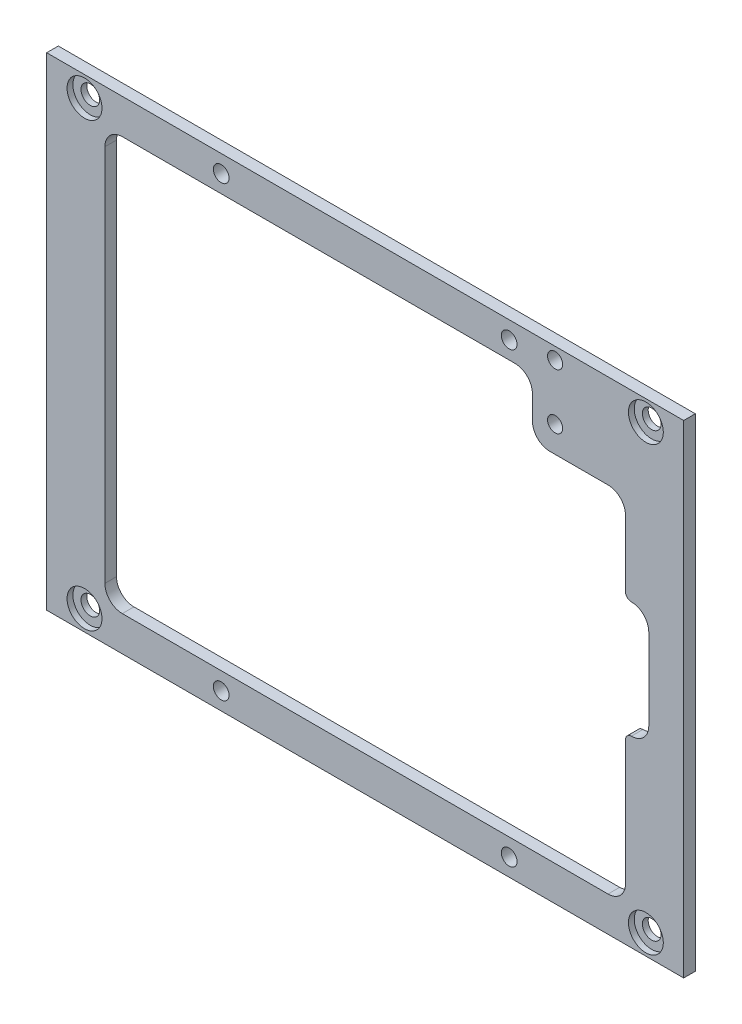
from build123d import *

# Parameters (mm, degrees)
SKETCH1_W                  = 109.5
SKETCH1_H                  = 83
BOSS_EXTRUDE1_DEPTH        = 2
F_3_2_3_2_DIAMETER_HOLE2_D = 3.2
F_2_6_2_6_DIAMETER_HOLE2_D = 2.6
F_2_6_2_6_DIAMETER_HOLE1_D = 2.6
SKETCH9_R                  = 3
CUT_EXTRUDE1_DEPTH         = 1
F_2_7_2_7_DIAMETER_HOLE1_D = 2.7
FILLET1_R                  = 1
FILLET2_R                  = 3


with BuildPart() as part:
    # Sketch1 → Boss-Extrude1 (new body)
    with BuildSketch(Plane.XY):
        with Locations((0, -41.5)):
            Rectangle(SKETCH1_W, SKETCH1_H)
        with BuildLine():
            Line((28.75, -9), (28.75, -13.1))
            ThreePointArc((28.75, -13.1), (29.628679656, -15.221320344), (31.75, -16.1))
            Line((31.75, -16.1), (41.75, -16.1))
            ThreePointArc((41.75, -16.1), (43.871320344, -16.978679656), (44.75, -19.1))
            Line((44.75, -19.1), (44.75, -31.5))
            Line((44.75, -31.5), (48.75, -31.5))
            Line((48.75, -31.5), (48.75, -41.5))
            Line((48.75, -41.5), (48.75, -51.5))
            Line((48.75, -51.5), (44.75, -51.5))
            Line((44.75, -51.5), (44.75, -74))
            ThreePointArc((44.75, -74), (43.871320344, -76.121320344), (41.75, -77))
            Line((41.75, -77), (-41.75, -77))
            ThreePointArc((-41.75, -77), (-43.871320344, -76.121320344), (-44.75, -74))
            Line((-44.75, -74), (-44.75, -9))
            ThreePointArc((-44.75, -9), (-43.871320344, -6.878679656), (-41.75, -6))
            Line((-41.75, -6), (25.75, -6))
            ThreePointArc((25.75, -6), (27.871320344, -6.878679656), (28.75, -9))
        make_face(mode=Mode.SUBTRACT)
    extrude(amount=BOSS_EXTRUDE1_DEPTH)

    # Ø3.2 (3.2) Diameter Hole2 (through all)
    with Locations(Plane.XY.offset(2)):
        with Locations((-48.25, -3.5), (-48.25, -79.5), (48.25, -79.5), (48.25, -3.5)):
            Hole(F_3_2_3_2_DIAMETER_HOLE2_D / 2)

    # Ø2.6 (2.6) Diameter Hole2 (through all)
    with Locations(Plane.XY.offset(2)):
        with Locations((32.65, -11.6)):
            Hole(F_2_6_2_6_DIAMETER_HOLE2_D / 2)

    # Ø2.6 (2.6) Diameter Hole1 (through all)
    with Locations(Plane.XY.offset(2)):
        with Locations((32.65, -2.07)):
            Hole(F_2_6_2_6_DIAMETER_HOLE1_D / 2)

    # Sketch9 → Cut-Extrude1 (cut)
    with BuildSketch(Plane.XY.offset(2)):
        with Locations((-48.25, -3.5)):
            Circle(SKETCH9_R)
        with Locations((48.25, -3.5)):
            Circle(SKETCH9_R)
        with Locations((48.25, -79.5)):
            Circle(SKETCH9_R)
        with Locations((-48.25, -79.5)):
            Circle(SKETCH9_R)
    extrude(amount=-CUT_EXTRUDE1_DEPTH, mode=Mode.SUBTRACT)

    # Ø2.7 (2.7) Diameter Hole1 (through all)
    with Locations(Plane.XY.offset(2)):
        with Locations((-24.75, -3), (24.75, -3), (-24.75, -80), (24.75, -80)):
            Hole(F_2_7_2_7_DIAMETER_HOLE1_D / 2)

    # Fillet1
    fillet1_edges = [part.edges().sort_by_distance(p)[0] for p in [
        (44.75, -51.5, 1),
        (44.75, -31.5, 1),
    ]]
    fillet(fillet1_edges, radius=FILLET1_R)

    # Fillet2
    fillet2_edges = [part.edges().sort_by_distance(p)[0] for p in [
        (48.75, -31.5, 1),
        (48.75, -51.5, 1),
    ]]
    fillet(fillet2_edges, radius=FILLET2_R - 0.0001)  # a hair under: the kernel refuses the full size


solid = part.part
